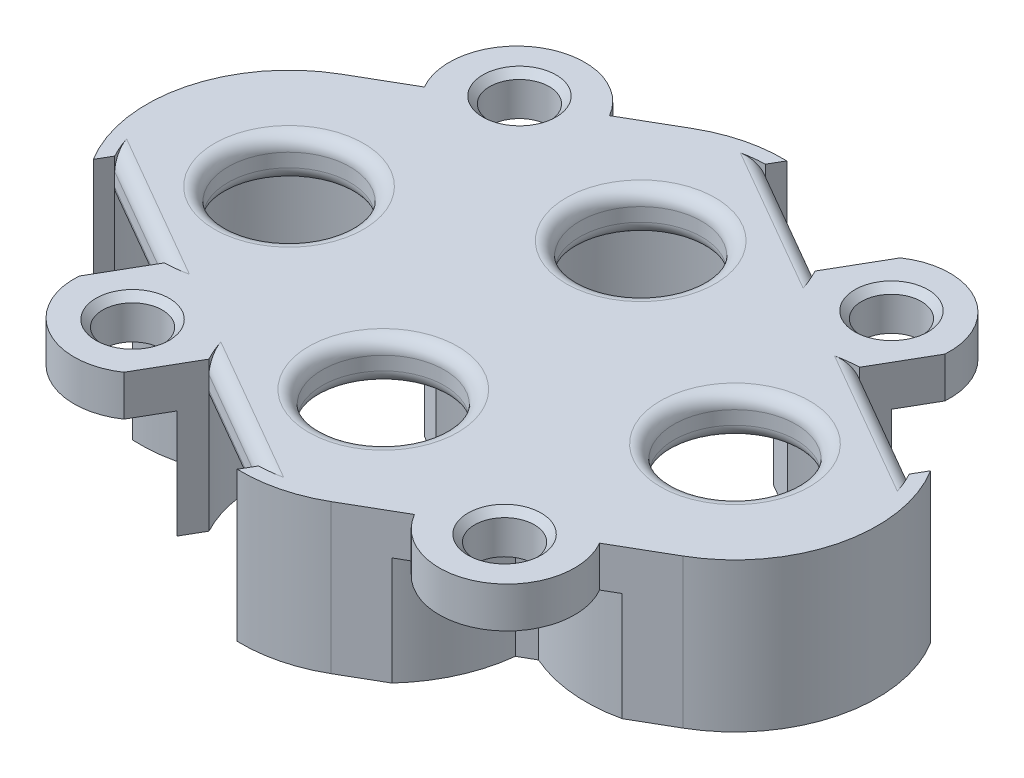
from build123d import *

# Parameters (mm, degrees)
SKETCH1_R                = 9.5
BOSS_EXTRUDE1_DEPTH      = 3
SKETCH1_4_R              = 9.5
BOSS_EXTRUDE2_DEPTH      = 3
BOSS_EXTRUDE3_START      = 8
BOSS_EXTRUDE3_DEPTH      = 19
BOSS_EXTRUDE4_DEPTH      = 3
CUT_EXTRUDE1_REACH       = 37.321
SKETCH4_R                = 2.2
CHAMFER1_SIZE            = 0.5
CHAMFER1_OF_MIRROR1_SIZE = 0.5
CUT_EXTRUDE2_REACH       = 40.569
FILLET1_R                = 1
BOSS_EXTRUDE5_DEPTH      = 8
BOSS_EXTRUDE5_DEPTH_BACK = 11
CUT_EXTRUDE3_DEPTH       = 36.320590854
CUT_EXTRUDE3_DEPTH_BACK  = 36.320590854
SKETCH7_W                = 53.908965344
SKETCH7_H                = 8
CUT_EXTRUDE4_REACH       = 36.504
SKETCH8_R                = 4.5
FILLET2_R                = 1


with BuildPart() as part:
    # Sketch1 → Boss-Extrude1 (new body)
    with BuildSketch(Plane(origin=(0, 0, 0), x_dir=(1, 0, 0), z_dir=(0, 1, 0))):
        with BuildLine():
            Line((-5.25, 18.59326674), (-21.704482672, 9.09326674))
            ThreePointArc((-21.704482672, 9.09326674), (-26.954482672, 0), (-21.704482672, -9.09326674))
            Line((-21.704482672, -9.09326674), (-5.25, -18.59326674))
            ThreePointArc((-5.25, -18.59326674), (0, -20), (5.25, -18.59326674))
            Line((5.25, -18.59326674), (21.704482672, -9.09326674))
            ThreePointArc((21.704482672, -9.09326674), (26.954482672, 0), (21.704482672, 9.09326674))
            Line((21.704482672, 9.09326674), (5.25, 18.59326674))
            ThreePointArc((5.25, 18.59326674), (0, 20), (-5.25, 18.59326674))
        make_face()
        with Locations(Location((0, -9.5, 0), (0, 0, 90))):
            Circle(SKETCH1_R, mode=Mode.SUBTRACT)
    extrude(amount=-BOSS_EXTRUDE1_DEPTH)

    # Sketch1<4> → Boss-Extrude2 (add)
    with BuildSketch(Plane(origin=(0, 0, 0), x_dir=(1, 0, 0), z_dir=(0, 1, 0))):
        with Locations((0, 9.5)):
            Circle(SKETCH1_4_R)
        with Locations((0, -9.5)):
            Circle(SKETCH1_4_R)
    extrude(amount=-BOSS_EXTRUDE2_DEPTH)

    # Sketch1<6> → Boss-Extrude3 (add)
    with BuildSketch(Plane(origin=(0, 0, 0), x_dir=(1, 0, 0), z_dir=(0, 1, 0)).offset(BOSS_EXTRUDE3_START)):
        with BuildLine():
            ThreePointArc((-11.958948382, -8.369000624), (-25.954482672, 0), (-11.958948382, 8.369000624))
            Line((-11.958948382, 8.369000624), (-9.49553429, 9.791253414))
            ThreePointArc((-9.49553429, 9.791253414), (-6.613739206, 16.319710677), (0, 19))
            Line((0, 19), (0, 20))
            ThreePointArc((0, 20), (-2.717599974, 19.642221176), (-5.25, 18.59326674))
            Line((-5.25, 18.59326674), (-8.089454173, 16.953907109))
            ThreePointArc((-8.089454173, 16.953907109), (-10.01434129, 14.051150241), (-10.935213074, 10.692105287))
            ThreePointArc((-10.935213074, 10.692105287), (-10.982339992, 10.123063642), (-10.999875463, 9.552343178))
            ThreePointArc((-10.999875463, 9.552343178), (-11.502901618, 9.822517247), (-12.019269597, 10.066224962))
            ThreePointArc((-12.019269597, 10.066224962), (-15.388723752, 10.94824908), (-18.865028499, 10.732626371))
            Line((-18.865028499, 10.732626371), (-21.704482672, 9.09326674))
            ThreePointArc((-21.704482672, 9.09326674), (-26.954482672, 0), (-21.704482672, -9.09326674))
            Line((-21.704482672, -9.09326674), (-18.865028499, -10.732626371))
            ThreePointArc((-18.865028499, -10.732626371), (-15.388723752, -10.94824908), (-12.019269597, -10.066224962))
            ThreePointArc((-12.019269597, -10.066224962), (-11.502901618, -9.822517247), (-10.999875463, -9.552343178))
            ThreePointArc((-10.999875463, -9.552343178), (-10.982339992, -10.123063642), (-10.935213074, -10.692105287))
            ThreePointArc((-10.935213074, -10.692105287), (-10.01434129, -14.051150241), (-8.089454173, -16.953907109))
            Line((-8.089454173, -16.953907109), (-5.25, -18.59326674))
            ThreePointArc((-5.25, -18.59326674), (-2.717599974, -19.642221176), (0, -20))
            Line((0, -20), (0, -19))
            ThreePointArc((0, -19), (-6.613739206, -16.319710677), (-9.49553429, -9.791253414))
            Line((-9.49553429, -9.791253414), (-11.958948382, -8.369000624))
        make_face()
        with BuildLine():
            ThreePointArc((-10.999875463, 9.552343178), (-10.982339992, 10.123063642), (-10.935213074, 10.692105287))
            Line((-10.935213074, 10.692105287), (-12.019269597, 10.066224962))
            ThreePointArc((-12.019269597, 10.066224962), (-11.502901618, 9.822517247), (-10.999875463, 9.552343178))
        make_face()
        with BuildLine():
            Line((-12.019269597, -10.066224962), (-10.935213074, -10.692105287))
            ThreePointArc((-10.935213074, -10.692105287), (-10.982339992, -10.123063642), (-10.999875463, -9.552343178))
            ThreePointArc((-10.999875463, -9.552343178), (-11.502901618, -9.822517247), (-12.019269597, -10.066224962))
        make_face()
    boss_extrude3 = extrude(amount=-BOSS_EXTRUDE3_DEPTH)

    # Sketch3 → Boss-Extrude4 (add)
    with BuildSketch(Plane(origin=(0, 0, 0), x_dir=(1, 0, 0), z_dir=(0, 1, 0))):
        with BuildLine():
            Line((-17.807368355, -11.34326674), (-9.147114317, -16.34326674))
            ThreePointArc((-9.147114317, -16.34326674), (-15.977241336, -18.173393759), (-17.807368355, -11.34326674))
        make_face()
        with BuildLine():
            Line((-17.807368355, 11.34326674), (-9.147114317, 16.34326674))
            ThreePointArc((-9.147114317, 16.34326674), (-15.977241336, 18.173393759), (-17.807368355, 11.34326674))
        make_face()
    boss_extrude4 = extrude(amount=-BOSS_EXTRUDE4_DEPTH)

    # Sketch4 → Cut-Extrude1 (cut, up to next)
    with BuildSketch(Plane(origin=(0, 0, 0), x_dir=(1, 0, 0), z_dir=(0, 1, 0)), mode=Mode.PRIVATE) as cut_extrude1_sk1:
        with Locations(Location((-13.727241336, -14.276279442, 0), (0, 0, 270))):
            Circle(SKETCH4_R)
    cut_extrude1_tool1 = extrude(cut_extrude1_sk1.sketch, amount=-CUT_EXTRUDE1_REACH, mode=Mode.PRIVATE) & part.part
    # Sketch4 → Cut-Extrude1 (cut, up to next)
    with BuildSketch(Plane(origin=(0, 0, 0), x_dir=(1, 0, 0), z_dir=(0, 1, 0)), mode=Mode.PRIVATE) as cut_extrude1_sk2:
        with Locations(Location((-13.727241336, 14.276279442, 0), (0, 0, 270))):
            Circle(SKETCH4_R)
    cut_extrude1_tool2 = extrude(cut_extrude1_sk2.sketch, amount=-CUT_EXTRUDE1_REACH, mode=Mode.PRIVATE) & part.part
    cut_extrude1_1 = cut_extrude1_tool1.solids().sort_by_distance((-13.727241, 0, 14.276279))[0]
    add(cut_extrude1_1, mode=Mode.SUBTRACT)
    cut_extrude1_2 = cut_extrude1_tool2.solids().sort_by_distance((-13.727241, 0, -14.276279))[0]
    add(cut_extrude1_2, mode=Mode.SUBTRACT)
    cut_extrude1 = cut_extrude1_1 + cut_extrude1_2  # Cut-Extrude1 as one shape, for the pattern or mirror that repeats it

    # Chamfer1
    chamfer1_edges = [part.edges().sort_by_distance(p)[0] for p in [
        (-13.727241336, 0, -16.476279442),
        (-13.727241336, 0, 12.076279442),
    ]]
    chamfer(chamfer1_edges, length=CHAMFER1_SIZE)

    # Mirror1: Boss-Extrude3, Boss-Extrude4, Cut-Extrude1 across plane
    add(boss_extrude3.mirror(Plane(origin=(0, 0, 0), x_dir=(0, 0, 1), z_dir=(1, 0, 0))))
    add(boss_extrude4.mirror(Plane(origin=(0, 0, 0), x_dir=(0, 0, 1), z_dir=(1, 0, 0))))
    add(cut_extrude1.mirror(Plane(origin=(0, 0, 0), x_dir=(0, 0, 1), z_dir=(1, 0, 0))), mode=Mode.SUBTRACT)

    # Chamfer1 of Mirror1
    chamfer1_of_mirror1_edges = [part.edges().sort_by_distance(p)[0] for p in [
        (13.727241336, 0, -16.476279442),
        (13.727241336, 0, 12.076279442),
    ]]
    chamfer(chamfer1_of_mirror1_edges, length=CHAMFER1_OF_MIRROR1_SIZE)

    # Sketch5 → Cut-Extrude2 (cut, up to next)
    with BuildSketch(Plane(origin=(0, 8, 0), x_dir=(1, 0, 0), z_dir=(0, 1, 0)), mode=Mode.PRIVATE) as cut_extrude2_sk1:
        Polygon((-24.823483296, -4.49553429), (-16.163229258, -9.49553429), (-18.464080389, -13.480725349), (-27.124334427, -8.480725349), align=None)
    cut_extrude2_tool1 = extrude(cut_extrude2_sk1.sketch, amount=-CUT_EXTRUDE2_REACH, mode=Mode.PRIVATE) & part.part
    # Sketch5 → Cut-Extrude2 (cut, up to next)
    with BuildSketch(Plane(origin=(0, 8, 0), x_dir=(1, 0, 0), z_dir=(0, 1, 0)), mode=Mode.PRIVATE) as cut_extrude2_sk2:
        Polygon((-8.369000624, -13.99553429), (0.291253414, -18.99553429), (-2.009597717, -22.980725349), (-10.669851755, -17.980725349), align=None)
    cut_extrude2_tool2 = extrude(cut_extrude2_sk2.sketch, amount=-CUT_EXTRUDE2_REACH, mode=Mode.PRIVATE) & part.part
    # Sketch5 → Cut-Extrude2 (cut, up to next)
    with BuildSketch(Plane(origin=(0, 8, 0), x_dir=(1, 0, 0), z_dir=(0, 1, 0)), mode=Mode.PRIVATE) as cut_extrude2_sk3:
        Polygon((-0.291253414, 18.99553429), (8.369000624, 13.99553429), (10.669851755, 17.980725349), (2.009597717, 22.980725349), align=None)
    cut_extrude2_tool3 = extrude(cut_extrude2_sk3.sketch, amount=-CUT_EXTRUDE2_REACH, mode=Mode.PRIVATE) & part.part
    # Sketch5 → Cut-Extrude2 (cut, up to next)
    with BuildSketch(Plane(origin=(0, 8, 0), x_dir=(1, 0, 0), z_dir=(0, 1, 0)), mode=Mode.PRIVATE) as cut_extrude2_sk4:
        Polygon((16.163229258, 9.49553429), (24.823483296, 4.49553429), (27.124334427, 8.480725349), (18.464080389, 13.480725349), align=None)
    cut_extrude2_tool4 = extrude(cut_extrude2_sk4.sketch, amount=-CUT_EXTRUDE2_REACH, mode=Mode.PRIVATE) & part.part
    add(cut_extrude2_tool1.solids().sort_by_distance((-21.643782, 8, 8.98813))[0], mode=Mode.SUBTRACT)
    add(cut_extrude2_tool2.solids().sort_by_distance((-5.189299, 8, 18.48813))[0], mode=Mode.SUBTRACT)
    add(cut_extrude2_tool3.solids().sort_by_distance((5.189299, 8, -18.48813))[0], mode=Mode.SUBTRACT)
    add(cut_extrude2_tool4.solids().sort_by_distance((21.643782, 8, -8.98813))[0], mode=Mode.SUBTRACT)

    # Fillet1
    # the kernel refuses this fillet: 1 mm, written as the material it takes off along each edge
    with BuildSketch(Plane(origin=(-13.998165749, 0, 10.74553429), x_dir=(0.49999999999999956, 0, -0.866025403784439), z_dir=(-0.8660254037844389, 0, -0.4999999999999995))) as fillet1_piece_1_section:
        with BuildLine():
            CenterArc((FILLET1_R, FILLET1_R), FILLET1_R, 180, 90)
            Line((0, FILLET1_R), (0, 0))
            Line((0, 0), (FILLET1_R, 0))
        make_face()
    fillet1_piece_1 = extrude(amount=15, mode=Mode.PRIVATE)
    fillet1_piece_1 = fillet1_piece_1 & Plane(origin=(-16.454482672, -0.134031424, 0), x_dir=(0.47321413577016985, 0, 0.8809474341340074), z_dir=(0, 1, 0)) * Cylinder(9.5, 34, mode=Mode.PRIVATE)
    add(fillet1_piece_1, mode=Mode.SUBTRACT)
    with BuildSketch(Plane(origin=(-13.998165749, -3, 10.74553429), x_dir=(0.49999999999999956, 0, -0.866025403784439), z_dir=(-0.8660254037844389, 0, -0.4999999999999995))) as fillet1_piece_2_section:
        with BuildLine():
            CenterArc((FILLET1_R, -FILLET1_R), FILLET1_R, 90, 90)
            Line((0, -FILLET1_R), (0, 0))
            Line((0, 0), (FILLET1_R, 0))
        make_face()
    fillet1_piece_2 = extrude(amount=15, mode=Mode.PRIVATE)
    fillet1_piece_2 = fillet1_piece_2 & Plane(origin=(-16.454482672, -2.865968576, 0), x_dir=(0.47321413577016985, 0, 0.8809474341340074), z_dir=(0, 1, 0)) * Cylinder(9.5, 34, mode=Mode.PRIVATE)
    add(fillet1_piece_2, mode=Mode.SUBTRACT)
    with BuildSketch(Plane(origin=(2.456316923, 0, 20.24553429), x_dir=(0, -1, 0), z_dir=(-0.8660254037844387, 0, -0.5000000000000001))) as fillet1_piece_3_section:
        with BuildLine():
            CenterArc((FILLET1_R, -FILLET1_R), FILLET1_R, 90, 90)
            Line((0, -FILLET1_R), (0, 0))
            Line((0, 0), (FILLET1_R, 0))
        make_face()
    fillet1_piece_3 = extrude(amount=15, mode=Mode.PRIVATE)
    fillet1_piece_3 = fillet1_piece_3 & Plane(origin=(0, -0.134033737, 9.5), x_dir=(0, 0, 1), z_dir=(0, 1, 0)) * Cylinder(9.5, 35, mode=Mode.PRIVATE)
    add(fillet1_piece_3, mode=Mode.SUBTRACT)
    with BuildSketch(Plane(origin=(2.456316923, -3, 20.24553429), x_dir=(0, 1, 0), z_dir=(-0.8660254037844387, 0, -0.5000000000000001))) as fillet1_piece_4_section:
        with BuildLine():
            CenterArc((FILLET1_R, FILLET1_R), FILLET1_R, 180, 90)
            Line((0, FILLET1_R), (0, 0))
            Line((0, 0), (FILLET1_R, 0))
        make_face()
    fillet1_piece_4 = extrude(amount=15, mode=Mode.PRIVATE)
    fillet1_piece_4 = fillet1_piece_4 & Plane(origin=(0, -2.865966263, 9.5), x_dir=(0, 0, 1), z_dir=(0, 1, 0)) * Cylinder(9.5, 35, mode=Mode.PRIVATE)
    add(fillet1_piece_4, mode=Mode.SUBTRACT)
    with BuildSketch(Plane(origin=(10.534064134, 0, -12.74553429), x_dir=(-0.4999999999999997, 0, 0.8660254037844389), z_dir=(-0.8660254037844388, 0, -0.49999999999999967))) as fillet1_piece_5_section:
        with BuildLine():
            CenterArc((FILLET1_R, -FILLET1_R), FILLET1_R, 90, 90)
            Line((0, -FILLET1_R), (0, 0))
            Line((0, 0), (FILLET1_R, 0))
        make_face()
    fillet1_piece_5 = extrude(amount=15, mode=Mode.PRIVATE)
    fillet1_piece_5 = fillet1_piece_5 & Plane(origin=(0, -0.134037096, -9.5), x_dir=(-0.9995299252438539, 0, -0.030658254060138262), z_dir=(0, 1, 0)) * Cylinder(9.5, 35, mode=Mode.PRIVATE)
    add(fillet1_piece_5, mode=Mode.SUBTRACT)
    with BuildSketch(Plane(origin=(10.534064134, -3, -12.74553429), x_dir=(-0.4999999999999997, 0, 0.8660254037844389), z_dir=(-0.8660254037844388, 0, -0.49999999999999967))) as fillet1_piece_6_section:
        with BuildLine():
            CenterArc((FILLET1_R, FILLET1_R), FILLET1_R, 180, 90)
            Line((0, FILLET1_R), (0, 0))
            Line((0, 0), (FILLET1_R, 0))
        make_face()
    fillet1_piece_6 = extrude(amount=15, mode=Mode.PRIVATE)
    fillet1_piece_6 = fillet1_piece_6 & Plane(origin=(0, -2.865962904, -9.5), x_dir=(-0.9995299252438539, 0, -0.030658254060138262), z_dir=(0, 1, 0)) * Cylinder(9.5, 35, mode=Mode.PRIVATE)
    add(fillet1_piece_6, mode=Mode.SUBTRACT)
    with BuildSketch(Plane(origin=(26.988546806, 0, -3.24553429), x_dir=(-0.4999999999999998, 0, 0.8660254037844387), z_dir=(-0.8660254037844388, 0, -0.49999999999999983))) as fillet1_piece_7_section:
        with BuildLine():
            CenterArc((FILLET1_R, -FILLET1_R), FILLET1_R, 90, 90)
            Line((0, -FILLET1_R), (0, 0))
            Line((0, 0), (FILLET1_R, 0))
        make_face()
    fillet1_piece_7 = extrude(amount=15, mode=Mode.PRIVATE)
    fillet1_piece_7 = fillet1_piece_7 & Plane(origin=(16.454482672, -0.134031424, 0), x_dir=(-0.47321413577016985, 0, 0.8809474341340074), z_dir=(0, 1, 0)) * Cylinder(9.5, 34, mode=Mode.PRIVATE)
    add(fillet1_piece_7, mode=Mode.SUBTRACT)
    with BuildSketch(Plane(origin=(26.988546806, -3, -3.24553429), x_dir=(0, 1, 0), z_dir=(-0.8660254037844388, 0, -0.49999999999999983))) as fillet1_piece_8_section:
        with BuildLine():
            CenterArc((FILLET1_R, -FILLET1_R), FILLET1_R, 90, 90)
            Line((0, -FILLET1_R), (0, 0))
            Line((0, 0), (FILLET1_R, 0))
        make_face()
    fillet1_piece_8 = extrude(amount=15, mode=Mode.PRIVATE)
    fillet1_piece_8 = fillet1_piece_8 & Plane(origin=(16.454482672, -2.865966111, 0), x_dir=(-0.47321413577016985, 0, 0.8809474341340074), z_dir=(0, 1, 0)) * Cylinder(9.5, 34, mode=Mode.PRIVATE)
    add(fillet1_piece_8, mode=Mode.SUBTRACT)

    # Sketch6 → Boss-Extrude5 (add, two sides: drawn at the far end of the back side and taken through both)
    with BuildSketch(Plane(origin=(0, 0, 0), x_dir=(1, 0, 0), z_dir=(0, 1, 0)).offset(-BOSS_EXTRUDE5_DEPTH_BACK)):
        with BuildLine():
            Line((-4.49553429, 1.130999376), (-6.454482672, 0))
            Line((-6.454482672, 0), (-4.49553429, -1.130999376))
            ThreePointArc((-4.49553429, -1.130999376), (-3.280047629, -0.584211333), (-2, -0.212912189))
            Line((-2, -0.212912189), (-2, 0.212912189))
            ThreePointArc((-2, 0.212912189), (-3.280047629, 0.584211333), (-4.49553429, 1.130999376))
        make_face()
        with BuildLine():
            ThreePointArc((4.49553429, 1.130999376), (3.280047629, 0.584211333), (2, 0.212912189))
            Line((2, 0.212912189), (2, -0.212912189))
            ThreePointArc((2, -0.212912189), (3.280047629, -0.584211333), (4.49553429, -1.130999376))
            Line((4.49553429, -1.130999376), (6.454482672, 0))
            Line((6.454482672, 0), (4.49553429, 1.130999376))
        make_face()
    extrude(amount=BOSS_EXTRUDE5_DEPTH + BOSS_EXTRUDE5_DEPTH_BACK)

    # Sketch7 → Cut-Extrude3 (cut, two sides: drawn at the far end of the back side and taken through both)
    with BuildSketch(Plane.XY.offset(-CUT_EXTRUDE3_DEPTH_BACK)):
        with Locations((0, 4)):
            Rectangle(SKETCH7_W, SKETCH7_H)
    extrude(amount=CUT_EXTRUDE3_DEPTH + CUT_EXTRUDE3_DEPTH_BACK, mode=Mode.SUBTRACT)

    # Sketch8 → Cut-Extrude4 (cut, up to next)
    with BuildSketch(Plane.XZ.offset(3), mode=Mode.PRIVATE) as cut_extrude4_sk1:
        with Locations(Location((-16.454482672, 0, 0), (0, 0, 270))):
            Circle(SKETCH8_R)
    cut_extrude4_tool1 = extrude(cut_extrude4_sk1.sketch, amount=-CUT_EXTRUDE4_REACH, mode=Mode.PRIVATE) & part.part
    # Sketch8 → Cut-Extrude4 (cut, up to next)
    with BuildSketch(Plane.XZ.offset(3), mode=Mode.PRIVATE) as cut_extrude4_sk2:
        with Locations(Location((0, 9.5, 0), (0, 0, 270))):
            Circle(SKETCH8_R)
    cut_extrude4_tool2 = extrude(cut_extrude4_sk2.sketch, amount=-CUT_EXTRUDE4_REACH, mode=Mode.PRIVATE) & part.part
    # Sketch8 → Cut-Extrude4 (cut, up to next)
    with BuildSketch(Plane.XZ.offset(3), mode=Mode.PRIVATE) as cut_extrude4_sk3:
        with Locations(Location((16.454482672, 0, 0), (0, 0, 270))):
            Circle(SKETCH8_R)
    cut_extrude4_tool3 = extrude(cut_extrude4_sk3.sketch, amount=-CUT_EXTRUDE4_REACH, mode=Mode.PRIVATE) & part.part
    # Sketch8 → Cut-Extrude4 (cut, up to next)
    with BuildSketch(Plane.XZ.offset(3), mode=Mode.PRIVATE) as cut_extrude4_sk4:
        with Locations(Location((0, -9.5, 0), (0, 0, 270))):
            Circle(SKETCH8_R)
    cut_extrude4_tool4 = extrude(cut_extrude4_sk4.sketch, amount=-CUT_EXTRUDE4_REACH, mode=Mode.PRIVATE) & part.part
    add(cut_extrude4_tool1.solids().sort_by_distance((-16.454483, -3, 0))[0], mode=Mode.SUBTRACT)
    add(cut_extrude4_tool2.solids().sort_by_distance((0, -3, 9.5))[0], mode=Mode.SUBTRACT)
    add(cut_extrude4_tool3.solids().sort_by_distance((16.454483, -3, 0))[0], mode=Mode.SUBTRACT)
    add(cut_extrude4_tool4.solids().sort_by_distance((0, -3, -9.5))[0], mode=Mode.SUBTRACT)

    # Fillet2
    fillet2_edges = [part.edges().sort_by_distance(p)[0] for p in [
        (-16.454482672, 0, 4.5),
        (-16.454482672, -3, 4.5),
        (0, 0, 14),
        (0, -3, 14),
        (16.454482672, 0, 4.5),
        (16.454482672, -3, 4.5),
        (0, 0, -5),
        (0, -3, -5),
    ]]
    fillet(fillet2_edges, radius=FILLET2_R)


solid = part.part
